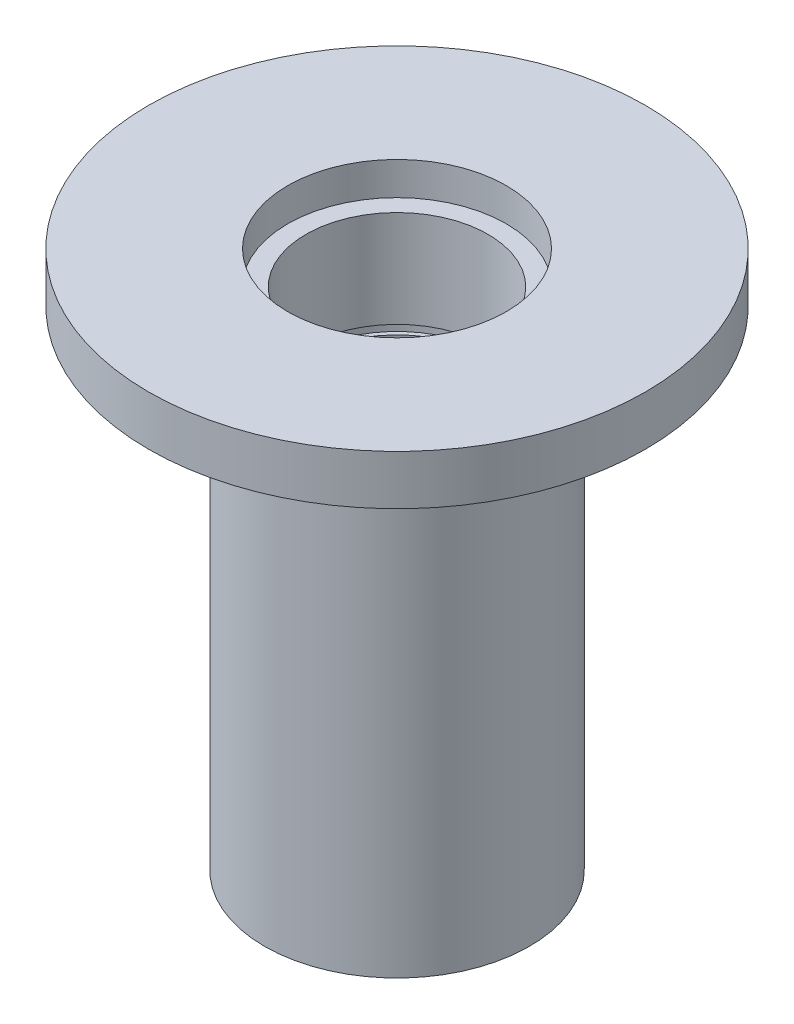
from build123d import *


with BuildPart() as part:
    # Sketch1 → Revolve1 (revolve)
    with BuildSketch(Plane.XY):
        Polygon((30, 0), (13.2, 0), (13.2, -4), (11, -4), (11, -15.7), (11.5, -15.7), (11.5, -16.8), (11, -16.8), (11, -31.2), (11.5, -31.2), (11.5, -32.3), (11, -32.3), (11, -65), (16, -65), (16, -6), (30, -6), align=None)
    revolve(axis=Axis((0, 0, 0), (0, -1, 0)))


solid = part.part
